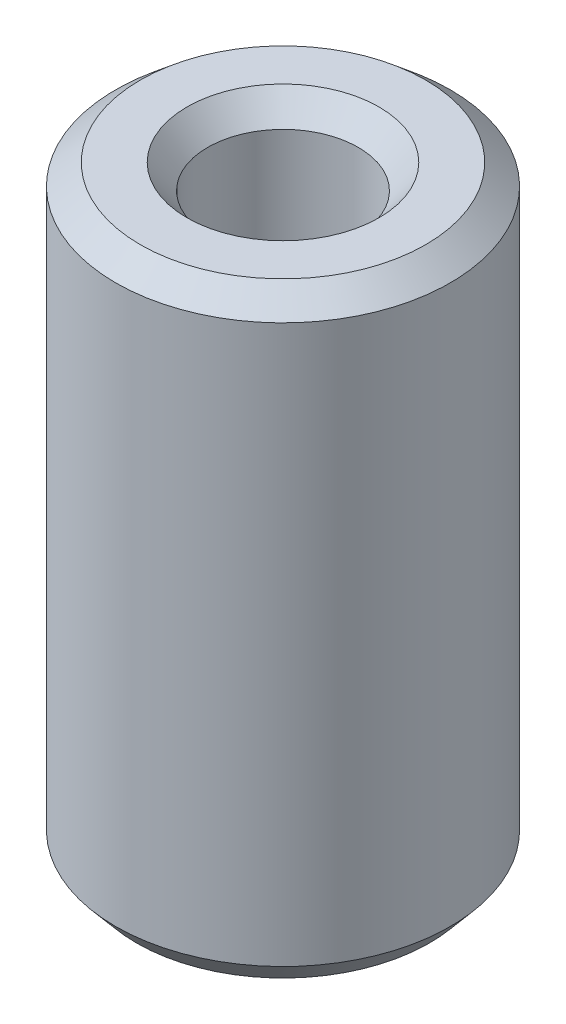
from build123d import *
from OCP.BRepFilletAPI import BRepFilletAPI_MakeChamfer

# Parameters (mm, degrees)
SKETCH1_R           = 5
BOSS_EXTRUDE1_DEPTH = 18.015507033
SKETCH2_R           = 2.250648402
CUT_EXTRUDE1_DEPTH  = 20.353513729
CHAMFER1_SIZE       = 0.619392765
CHAMFER1_SIZE2      = 0.73613452


with BuildPart() as part:
    # Sketch1 → Boss-Extrude1 (new body)
    with BuildSketch(Plane(origin=(0, 0, 0), x_dir=(1, 0, 0), z_dir=(0, 1, 0))):
        Circle(SKETCH1_R)
    extrude(amount=BOSS_EXTRUDE1_DEPTH)

    # Sketch2 → Cut-Extrude1 (cut, through all)
    with BuildSketch(Plane(origin=(0, 0, 0), x_dir=(1, 0, 0), z_dir=(0, 1, 0))):
        Circle(SKETCH2_R)
    extrude(amount=CUT_EXTRUDE1_DEPTH, mode=Mode.SUBTRACT)

    # Chamfer1: one chamfer whose edges measure the first distance from different faces: ONE call of the kernel's chamfer builder (chamfer() names one face for all edges)
    chamfer1_edges_1 = [part.edges().sort_by_distance(p)[0] for p in [
        (-2.250648402, 18.015507033, 0),
    ]]
    chamfer1_side_1 = [part.faces().sort_by_distance(p)[0] for p in [
        (-4.858578644, 18.015507033, 0),
    ]]
    chamfer1_edges_2 = [part.edges().sort_by_distance(p)[0] for p in [
        (-2.250648402, 0, 0),
    ]]
    chamfer1_side_2 = [part.faces().sort_by_distance(p)[0] for p in [
        (-2.250648402, 9.007753517, 0),
    ]]
    chamfer1_edges_3 = [part.edges().sort_by_distance(p)[0] for p in [
        (-5, 0, 0),
    ]]
    chamfer1_side_3 = [part.faces().sort_by_distance(p)[0] for p in [
        (-4.858578644, 0, 0),
    ]]
    chamfer1_edges_4 = [part.edges().sort_by_distance(p)[0] for p in [
        (-5, 18.015507033, 0),
    ]]
    chamfer1_side_4 = [part.faces().sort_by_distance(p)[0] for p in [
        (-5, 9.007753517, 0),
    ]]
    chamfer1 = BRepFilletAPI_MakeChamfer(part.part.solid().wrapped)
    for e in chamfer1_edges_1:
        chamfer1.Add(CHAMFER1_SIZE, CHAMFER1_SIZE2, e.wrapped, chamfer1_side_1[0].wrapped)  # the first distance lies on this face
    for e in chamfer1_edges_2:
        chamfer1.Add(CHAMFER1_SIZE, CHAMFER1_SIZE2, e.wrapped, chamfer1_side_2[0].wrapped)  # the first distance lies on this face
    for e in chamfer1_edges_3:
        chamfer1.Add(CHAMFER1_SIZE, CHAMFER1_SIZE2, e.wrapped, chamfer1_side_3[0].wrapped)  # the first distance lies on this face
    for e in chamfer1_edges_4:
        chamfer1.Add(CHAMFER1_SIZE, CHAMFER1_SIZE2, e.wrapped, chamfer1_side_4[0].wrapped)  # the first distance lies on this face
    add(Compound.cast(chamfer1.Shape()), mode=Mode.REPLACE)


solid = part.part
